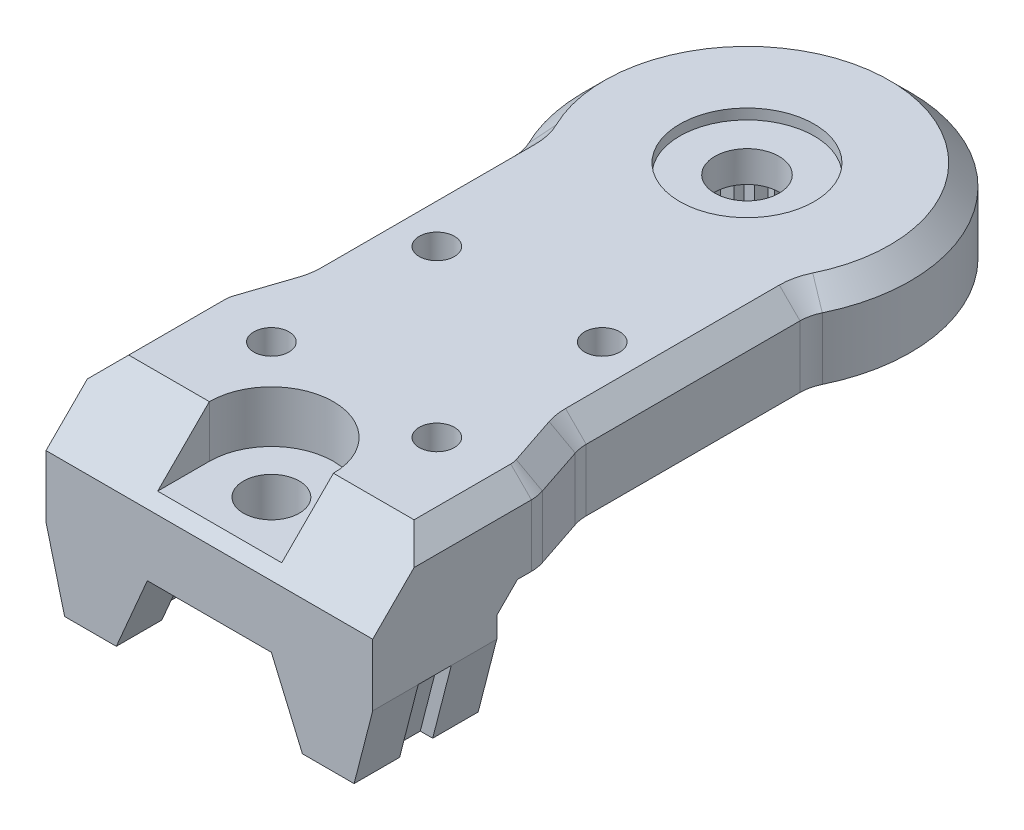
from build123d import *
from build123d.topology import SkipClean

# Parameters (mm, degrees)
EXTRUDE_1_DEPTH          = 4
EXTRUDE_3_DEPTH          = 6
CHAMFER_1_SIZE           = 3
SKETCH_5_R               = 0.85
CUT_EXTRUDE_1_DEPTH      = 4
PATTERN_LINEAR_1_COUNT   = 2
PATTERN_LINEAR_1_PITCH   = 8
CUT_EXTRUDE_2_DEPTH      = 2.5
CUT_EXTRUDE_3_REACH      = 30.061
SKETCH_7_R               = 1.35
SKETCH_8_R               = 3.95
EXTRUDE_4_DEPTH          = 1.2
SKETCH_9_R               = 3.25
CUT_EXTRUDE_4_DEPTH      = 0.5
SKETCH_10_R              = 1.55
CUT_EXTRUDE_5_DEPTH      = 29.786455148
FILLET_1_R               = 0.5
SKETCH_11_R              = 3
CUT_EXTRUDE_6_DEPTH      = 3.2
EXTRUDE_5_DEPTH          = 3.2
PATTERN_CIRCULAR_1_COUNT = 23
CUT_EXTRUDE_7_DEPTH      = 0.8
CUT_EXTRUDE_8_DEPTH      = 29.786455148
FILLET_2_R               = 2
CHAMFER_2_SIZE           = 1


with BuildPart() as part:
    # ｽｹｯﾁ1 → ﾎﾞｽ - 押し出し1 (new body)
    with BuildSketch(Plane(origin=(0, 0, 0), x_dir=(1, 0, 0), z_dir=(0, 1, 0))):
        with BuildLine():
            Line((-7.9, 0), (-7.9, -26))
            Line((-7.9, -26), (7.9, -26))
            Line((7.9, -26), (7.9, 0))
            ThreePointArc((7.9, 0), (0, 7.9), (-7.9, 0))
        make_face()
    extrude(amount=EXTRUDE_1_DEPTH)

    # ｽｹｯﾁ4 → ﾎﾞｽ - 押し出し3 (add)
    with BuildSketch(Plane.XY.offset(26)):
        Polygon((-7, -5.5), (-4.5, -5.5), (-3, -2), (3, -2), (4.5, -5.5), (7, -5.5), (7.9, -2), (7.9, 0), (-7.9, 0), (-7.9, -2), align=None)
    extrude(amount=-EXTRUDE_3_DEPTH)

    # 面取り1
    chamfer_1_edges = [part.edges().sort_by_distance(p)[0] for p in [
        (0, 4, 26),
    ]]
    chamfer(chamfer_1_edges, length=CHAMFER_1_SIZE)

    # ｽｹｯﾁ5 → ｶｯﾄ - 押し出し1 (cut)
    with BuildSketch(Plane(origin=(0, 4, 0), x_dir=(1, 0, 0), z_dir=(0, 1, 0))):
        with Locations(Location((-4, -19, 0), (0, 0, 270))):
            Circle(SKETCH_5_R)
        with Locations(Location((4, -19, 0), (0, 0, 270))):
            Circle(SKETCH_5_R)
    cut_extrude_1 = extrude(amount=-CUT_EXTRUDE_1_DEPTH, mode=Mode.SUBTRACT)

    # 直線ﾊﾟﾀｰﾝ1: ｶｯﾄ - 押し出し1 ×2
    with Locations(*[(0, 0, -i * PATTERN_LINEAR_1_PITCH) for i in range(1, PATTERN_LINEAR_1_COUNT)]):
        add(cut_extrude_1, mode=Mode.SUBTRACT)

    # ｽｹｯﾁ6 → ｶｯﾄ - 押し出し2 (cut)
    with BuildSketch(Plane(origin=(0, 4, 0), x_dir=(1, 0, 0), z_dir=(0, 1, 0))):
        with BuildLine():
            Line((-3, -23), (-3, -27))
            Line((-3, -27), (3, -27))
            Line((3, -27), (3, -23))
            ThreePointArc((3, -23), (0, -20), (-3, -23))
        make_face()
    extrude(amount=-CUT_EXTRUDE_2_DEPTH, mode=Mode.SUBTRACT)

    # ｽｹｯﾁ7 → ｶｯﾄ - 押し出し3 (cut, up to next)
    with BuildSketch(Plane(origin=(0, 1.5, 0), x_dir=(1, 0, 0), z_dir=(0, 1, 0)), mode=Mode.PRIVATE) as cut_extrude_3_sk1:
        with Locations(Location((0, -23, 0), (0, 0, 270))):
            Circle(SKETCH_7_R)
    cut_extrude_3_tool1 = extrude(cut_extrude_3_sk1.sketch, amount=-CUT_EXTRUDE_3_REACH, mode=Mode.PRIVATE) & part.part
    add(cut_extrude_3_tool1.solids().sort_by_distance((0, 1.5, 23))[0], mode=Mode.SUBTRACT)

    # ｽｹｯﾁ8 → ﾎﾞｽ - 押し出し4 (add)
    with BuildSketch(Plane.XZ):
        with Locations(Location((0, 0, 0), (0, 0, 90))):
            Circle(SKETCH_8_R)
    extrude(amount=EXTRUDE_4_DEPTH)

    # ｽｹｯﾁ9 → ｶｯﾄ - 押し出し4 (cut)
    with BuildSketch(Plane(origin=(0, 4, 0), x_dir=(1, 0, 0), z_dir=(0, 1, 0))):
        with Locations(Location((0, 0, 0), (0, 0, 270))):
            Circle(SKETCH_9_R)
    extrude(amount=-CUT_EXTRUDE_4_DEPTH, mode=Mode.SUBTRACT)

    # ｽｹｯﾁ10 → ｶｯﾄ - 押し出し5 (cut, through all)
    with BuildSketch(Plane(origin=(0, 4, 0), x_dir=(1, 0, 0), z_dir=(0, 1, 0))):
        with Locations(Location((0, 0, 0), (0, 0, 270))):
            Circle(SKETCH_10_R)
    extrude(amount=-CUT_EXTRUDE_5_DEPTH, mode=Mode.SUBTRACT)

    # ﾌｨﾚｯﾄ1
    fillet_1_edges = [part.edges().sort_by_distance(p)[0] for p in [
        (0, 0, -3.95),
    ]]
    fillet(fillet_1_edges, radius=FILLET_1_R)

    # ｽｹｯﾁ11 → ｶｯﾄ - 押し出し6 (cut)
    with BuildSketch(Plane.XZ.offset(1.2)):
        with Locations(Location((0, 0, 0), (0, 0, 270))):
            Circle(SKETCH_11_R)
    extrude(amount=-CUT_EXTRUDE_6_DEPTH, mode=Mode.SUBTRACT)

    # ｽｹｯﾁ12 → ﾎﾞｽ - 押し出し5 (add)
    with BuildSketch(Plane.XZ.offset(1.2)):
        with BuildLine():
            Line((-0.408499947, 2.972057838), (0, 2.574530741))
            Line((0, 2.574530741), (0.408499947, 2.972057838))
            ThreePointArc((0.408499947, 2.972057838), (0, 3), (-0.408499947, 2.972057838))
        make_face()
    extrude_5 = extrude(amount=-EXTRUDE_5_DEPTH)

    # 円形ﾊﾟﾀｰﾝ1: ﾎﾞｽ - 押し出し5 ×23 about axis
    pattern_circular_1_axis = Axis((0, 0, 0), (0, 1, 0))
    for i in range(1, PATTERN_CIRCULAR_1_COUNT):
        add(extrude_5.rotate(pattern_circular_1_axis, i * 360 / PATTERN_CIRCULAR_1_COUNT))

    # ｽｹｯﾁ13 → ｶｯﾄ - 押し出し7 (cut, symmetric)
    with BuildSketch(Plane.XY.offset(23)):
        Polygon((3, -2), (4.5, -5.5), (5.1, -5.5), (3.6, -2), align=None)
        Polygon((7.9, -2), (7, -5.5), (6.4, -5.5), (7.3, -2), align=None)
    cut_extrude_7 = extrude(amount=CUT_EXTRUDE_7_DEPTH, both=True, mode=Mode.SUBTRACT)

    # ﾐﾗｰ1: ｶｯﾄ - 押し出し7 across plane
    add(cut_extrude_7.mirror(Plane(origin=(0, 0, 0), x_dir=(0, 0, 1), z_dir=(1, 0, 0))), mode=Mode.SUBTRACT)

    # ｽｹｯﾁ14 → ｶｯﾄ - 押し出し8 (cut, through all)
    with SkipClean():  # the faces are left unmerged after this step: merging them gives an invalid solid
        with BuildSketch(Plane(origin=(0, 4, 0), x_dir=(1, 0, 0), z_dir=(0, 1, 0))):
            with BuildLine():
                Line((-7.9, 0), (-7.9, -18))
                Line((-7.9, -18), (-6.9, -15))
                Line((-6.9, -15), (-6.9, -3.847076812))
                ThreePointArc((-6.9, -3.847076812), (-7.645913941, -1.987460691), (-7.9, 0))
            make_face()
        cut_extrude_8 = extrude(amount=-CUT_EXTRUDE_8_DEPTH, mode=Mode.SUBTRACT)

    # ﾐﾗｰ2: ｶｯﾄ - 押し出し8 across plane
    with SkipClean():  # the faces are left unmerged after this step: merging them gives an invalid solid
        add(cut_extrude_8.mirror(Plane(origin=(0, 0, 0), x_dir=(0, 0, 1), z_dir=(1, 0, 0))), mode=Mode.SUBTRACT)

    # ﾌｨﾚｯﾄ2
    fillet_2_edges = [part.edges().sort_by_distance(p)[0] for p in [
        (-6.9, 2, 3.847076812),
        (-6.9, 2, 15),
        (-7.9, 2, 18),
        (6.9, 2, 3.847076812),
        (7.9, 2, 18),
        (6.9, 2, 15),
    ]]
    fillet(fillet_2_edges, radius=FILLET_2_R)

    # 面取り2
    # the kernel refuses this chamfer: 1 mm, written as the material it adds along each edge
    with BuildSketch(Plane(origin=(7.9, 0, 20), x_dir=(0, 0.02749587661058639, -0.9996219169112968), z_dir=(-1, 0, 0))) as chamfer_2_piece_1_section:
        Polygon((CHAMFER_2_SIZE * 0.999621916911, CHAMFER_2_SIZE * 0.0274958766106), (-CHAMFER_2_SIZE * 0.0274958766106, CHAMFER_2_SIZE * 0.999621916911), (0, 0), align=None)
    chamfer_2_piece_1 = extrude(amount=15.8, mode=Mode.PRIVATE)
    chamfer_2_piece_1 = chamfer_2_piece_1 - Plane(origin=(-4, -0.34097177, 19), x_dir=(0, 0, 1), z_dir=(0, 1, 0)) * Cylinder(0.85, 36, mode=Mode.PRIVATE)
    chamfer_2_piece_1 = chamfer_2_piece_1 - Plane(origin=(4, -0.34097177, 19), x_dir=(0, 0, 1), z_dir=(0, 1, 0)) * Cylinder(0.85, 36, mode=Mode.PRIVATE)
    add(chamfer_2_piece_1)
    # the kernel refuses this chamfer: 1 mm, written as the material it takes off along each edge
    with BuildSketch(Plane(origin=(-7.9, 4, 18.32455532), x_dir=(-0.027495876610586487, -0.9996219169112968, 0), z_dir=(0, 0, 1)), Plane(origin=(7.9, 4, 25.571682988), x_dir=(0.027495876610586487, -0.9996219169112968, 0), z_dir=(0, 0, -1))) as chamfer_2_2_piece_1:
        Polygon((CHAMFER_2_SIZE * 0.999621916911, CHAMFER_2_SIZE * 0.0274958766106), (-CHAMFER_2_SIZE * 0.0274958766106, CHAMFER_2_SIZE * 0.999621916911), (0, 0), align=None)
    extrude(amount=7.247127668, mode=Mode.SUBTRACT)
    with BuildSketch(Plane(origin=(0, 4, 0), x_dir=(1, 0, 0), z_dir=(0, 0, 1))) as chamfer_2_2_piece_2:
        Polygon((7.9, -CHAMFER_2_SIZE), (7.9 - CHAMFER_2_SIZE, 0), (7.9, 0), align=None)
    revolve(axis=Axis((0, 4, 0), (0, 1, 0)), revolution_arc=180, mode=Mode.SUBTRACT)
    with BuildSketch(Plane(origin=(-5.9, 4, 18.32455532), x_dir=(-1, 0, 0), z_dir=(0, 0, 1))) as chamfer_2_2_piece_3:
        Polygon((2, CHAMFER_2_SIZE), (2 - CHAMFER_2_SIZE, 0), (2, 0), align=None)
    revolve(axis=Axis((-5.9, 4, 18.32455532), (0, -1, 0)), revolution_arc=18.434948823, mode=Mode.SUBTRACT)
    with BuildSketch(Plane(origin=(-7.797366596, 4, 17.692099788), x_dir=(-0.026084878905721698, -0.9996219169112968, -0.008694959635240574), z_dir=(0.3162277660168382, 0, -0.9486832980505138))) as chamfer_2_2_piece_4:
        Polygon((CHAMFER_2_SIZE * 0.999621916911, -CHAMFER_2_SIZE * 0.0274958766106), (-CHAMFER_2_SIZE * 0.0274958766106, -CHAMFER_2_SIZE * 0.999621916911), (0, 0), align=None)
    extrude(amount=2.513167019, mode=Mode.SUBTRACT)
    with BuildSketch(Plane(origin=(-8.9, 4, 14.67544468), x_dir=(0.9486832980505138, 0, 0.31622776601683794), z_dir=(-0.31622776601683794, 0, 0.9486832980505138))) as chamfer_2_2_piece_5:
        Polygon((2, -CHAMFER_2_SIZE), (2 + CHAMFER_2_SIZE, 0), (2, 0), align=None)
    revolve(axis=Axis((-8.9, 4, 14.67544468), (0, 1, 0)), revolution_arc=18.434948823, mode=Mode.SUBTRACT)
    with BuildSketch(Plane(origin=(-6.9, 4, 14.67544468), x_dir=(-0.027495876610586487, -0.9996219169112968, 0), z_dir=(0, 0, -1))) as chamfer_2_2_piece_6:
        Polygon((CHAMFER_2_SIZE * 0.999621916911, -CHAMFER_2_SIZE * 0.0274958766106), (-CHAMFER_2_SIZE * 0.0274958766106, -CHAMFER_2_SIZE * 0.999621916911), (0, 0), align=None)
    extrude(amount=10.339548002, mode=Mode.SUBTRACT)
    with BuildSketch(Plane(origin=(-8.9, 4, 4.335896678), x_dir=(1, 0, 0), z_dir=(0, 0, 1))) as chamfer_2_2_piece_7:
        Polygon((2, -CHAMFER_2_SIZE), (2 + CHAMFER_2_SIZE, 0), (2, 0), align=None)
    revolve(axis=Axis((-8.9, 4, 4.335896678), (0, 1, 0)), revolution_arc=25.974390018, mode=Mode.SUBTRACT)
    with BuildSketch(Plane(origin=(8.9, 4, 4.335896678), x_dir=(-0.8989898989898986, 0, -0.43796936138745124), z_dir=(0.43796936138745124, 0, -0.8989898989898986))) as chamfer_2_2_piece_8:
        Polygon((2, -CHAMFER_2_SIZE), (2 + CHAMFER_2_SIZE, 0), (2, 0), align=None)
    revolve(axis=Axis((8.9, 4, 4.335896678), (0, 1, 0)), revolution_arc=25.974390018, mode=Mode.SUBTRACT)
    with BuildSketch(Plane(origin=(6.9, 4, 14.67544468), x_dir=(0.027495876610586487, -0.9996219169112968, 0), z_dir=(0, 0, -1))) as chamfer_2_2_piece_9:
        Polygon((CHAMFER_2_SIZE * 0.999621916911, CHAMFER_2_SIZE * 0.0274958766106), (-CHAMFER_2_SIZE * 0.0274958766106, CHAMFER_2_SIZE * 0.999621916911), (0, 0), align=None)
    extrude(amount=10.339548002, mode=Mode.SUBTRACT)
    with BuildSketch(Plane(origin=(8.9, 4, 14.67544468), x_dir=(-1, 0, 0), z_dir=(0, 0, -1))) as chamfer_2_2_piece_10:
        Polygon((2, -CHAMFER_2_SIZE), (2 + CHAMFER_2_SIZE, 0), (2, 0), align=None)
    revolve(axis=Axis((8.9, 4, 14.67544468), (0, 1, 0)), revolution_arc=18.434948823, mode=Mode.SUBTRACT)
    with BuildSketch(Plane(origin=(7.797366596, 4, 17.692099788), x_dir=(0.02608487890572092, -0.9996219169112968, -0.008694959635240314), z_dir=(-0.3162277660168382, 0, -0.9486832980505138))) as chamfer_2_2_piece_11:
        Polygon((CHAMFER_2_SIZE * 0.999621916911, CHAMFER_2_SIZE * 0.0274958766106), (-CHAMFER_2_SIZE * 0.0274958766106, CHAMFER_2_SIZE * 0.999621916911), (0, 0), align=None)
    extrude(amount=2.513167019, mode=Mode.SUBTRACT)
    with BuildSketch(Plane(origin=(5.9, 4, 18.32455532), x_dir=(0.9486832980505135, 0, -0.3162277660168389), z_dir=(-0.3162277660168389, 0, -0.9486832980505135))) as chamfer_2_2_piece_12:
        Polygon((2, CHAMFER_2_SIZE), (2 - CHAMFER_2_SIZE, 0), (2, 0), align=None)
    revolve(axis=Axis((5.9, 4, 18.32455532), (0, -1, 0)), revolution_arc=18.434948823, mode=Mode.SUBTRACT)
    with BuildSketch(Plane(origin=(0, 4, 0), x_dir=(0.8989898989898988, 0, 0.43796936138745096), z_dir=(-0.43796936138745096, 0, 0.8989898989898988))) as chamfer_2_2_piece_13:
        Polygon((7.9, -CHAMFER_2_SIZE), (7.9 - CHAMFER_2_SIZE, 0), (7.9, 0), align=None)
    revolve(axis=Axis((0, 4, 0), (0, 1, 0)), revolution_arc=25.974390018, mode=Mode.SUBTRACT)
    with BuildSketch(Plane(origin=(0, 4, 0), x_dir=(-0.8989898989898988, 0, 0.43796936138745096), z_dir=(0.43796936138745096, 0, 0.8989898989898988))) as chamfer_2_2_piece_14:
        Polygon((7.9, CHAMFER_2_SIZE), (7.9 - CHAMFER_2_SIZE, 0), (7.9, 0), align=None)
    revolve(axis=Axis((0, 4, 0), (0, -1, 0)), revolution_arc=25.974390018, mode=Mode.SUBTRACT)


solid = part.part
